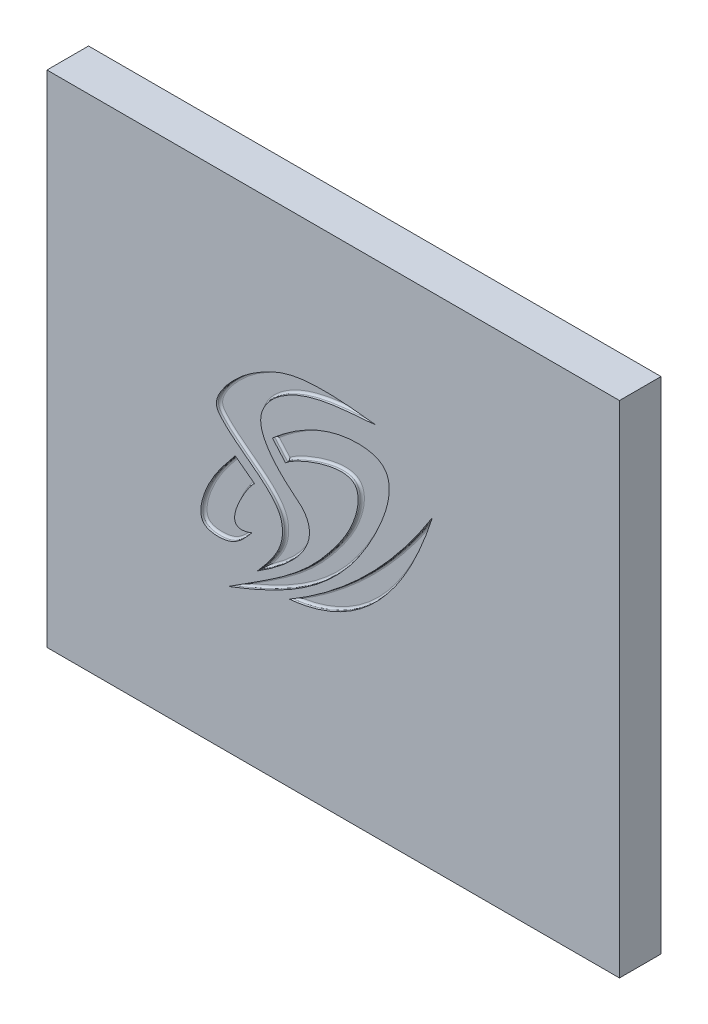
from build123d import *

# Parameters (mm, degrees)
SKETCH2_W           = 137.791531569
SKETCH2_H           = 120.370733533
BOSS_EXTRUDE1_DEPTH = 10
CUT_EXTRUDE3_START  = 10
CUT_EXTRUDE3_DEPTH  = 1
FILLET1_R           = 0.5


with BuildPart() as part:
    # Sketch2 → Boss-Extrude1 (new body)
    with BuildSketch(Plane.XY):
        with Locations((31.8270293, 27.32578323)):
            Rectangle(SKETCH2_W, SKETCH2_H)
    extrude(amount=BOSS_EXTRUDE1_DEPTH)

    # Sketch1 → Cut-Extrude3 (cut)
    with BuildSketch(Plane.XY.offset(CUT_EXTRUDE3_START)):
        with BuildLine():
            Line((17.176065514, 37.940577635), (20.377645725, 34.29411657))
            add(Edge.make_bspline(
                [(20.377645725, 34.29411657), (21.79877127, 36.044926624), (40.600955137, 44.381265173), (37.146757125, 29.665564919), (25.972449226, 13.407903742), (18.764563017, 9.558736625), (6.61446643, 1.706497612)],
                knots=[0, 0, 0, 0, 0.260916896, 0.422293683, 0.496201994, 1, 1, 1, 1], degree=3))
            add(Edge.make_bspline(
                [(17.176065514, 37.940577635), (20.687673387, 40.933663412), (29.596591318, 47.686586451), (48.746242309, 47.093271091), (37.456924735, 15.333791893), (20.529228296, 7.064578252), (6.61446643, 1.706497612)],
                knots=[0, 0, 0, 0, 0.203362102, 0.322878188, 0.508121589, 1, 1, 1, 1], degree=3))
        make_face()
        with BuildLine():
            Line((12.933476083, 26.215725432), (8.237367495, 29.746886893))
            add(Edge.make_bspline(
                [(8.237367495, 29.746886893), (6.38694395, 27.414016434), (0.901683576, 21.513486078), (-0.844835097, 11.169308315), (7.234304489, 10.459251033), (9.788533757, 12.722350627), (12.259278166, 15.704283534)],
                knots=[0, 0, 0, 0, 0.420232041, 0.607546836, 0.741966865, 1, 1, 1, 1], degree=3))
            add(Edge.make_bspline(
                [(12.933476083, 26.215725432), (12.160001299, 26.497973921), (2.887066792, 12.04242411), (12.259278166, 15.704283534)],
                knots=[0.013809831, 0.013809831, 0.013809831, 0.013809831, 1, 1, 1, 1], degree=3))
        make_face()
        with BuildLine():
            add(Edge.make_bspline(
                [(41.931526618, 53.105470173), (38.869290056, 52.558875738), (24.117152234, 52.895736075), (9.723443598, 40.338108388), (20.231653601, 30.181138018), (25.865224751, 26.010326352), (28.952268691, 18.05683), (13.562719027, 8.395183554)],
                knots=[0, 0, 0, 0, 0.313517558, 0.565748944, 0.823694886, 0.867119992, 1, 1, 1, 1], degree=3))
            add(Edge.make_bspline(
                [(41.931526618, 53.105470173), (25.445324973, 55.12062488), (19.23048983, 53.317493751), (8.378234638, 46.574982341), (2.329524793, 39.235089527), (7.934251374, 31.848779577), (18.904381647, 26.612988576), (19.957933914, 17.527958356), (18.392566221, 13.839498249), (13.562719027, 8.395183554)],
                knots=[0, 0, 0, 0, 0.176333835, 0.210773939, 0.329553592, 0.388267349, 0.739197749, 0.804757644, 1, 1, 1, 1], degree=3))
        make_face()
        with BuildLine():
            add(Edge.make_bspline(
                [(55.700433095, 40.584807381), (45.436184184, 8.647543812), (21.2829144, 6.388860695)],
                knots=[0, 0, 0, 1, 1, 1], degree=2))
            add(Edge.make_bspline(
                [(21.2829144, 6.388860695), (41.630018201, 18.261599797), (55.700433095, 40.584807381)],
                knots=[0, 0, 0, 1, 1, 1], degree=2))
        make_face()
    extrude(amount=-CUT_EXTRUDE3_DEPTH, mode=Mode.SUBTRACT)

    # Fillet1
    fillet1_edges = [part.edges().sort_by_distance(p)[0] for p in [
        (10.585421789, 27.981306163, 9),
        (0.00026395, 14.990856052, 9),
        (8.791744815, 19.692650383, 9),
        (41.667401723, 29.754464607, 9),
        (18.77685562, 36.117347102, 9),
        (32.328779737, 22.782068869, 9),
        (40.060845974, 20.874216917, 9),
        (41.963928966, 16.067188925, 9),
        (15.124466032, 43.244495864, 9),
        (9.910579635, 31.620426318, 9),
    ]]
    fillet(fillet1_edges, radius=FILLET1_R - 0.0001)  # a hair under: the kernel refuses the full size


solid = part.part
